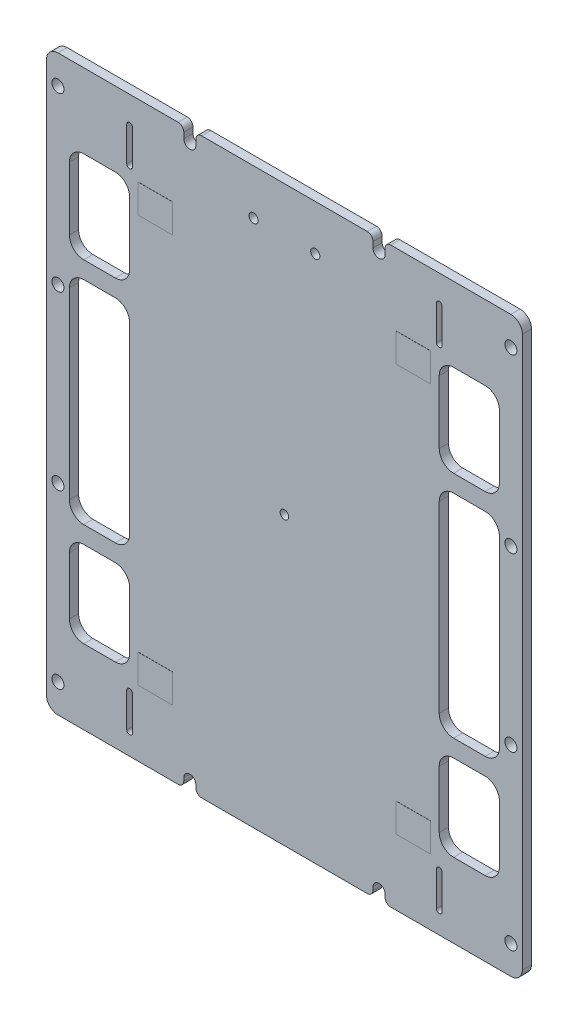
from build123d import *

# Parameters (mm, degrees)
BOARDOUTLINE_DEPTH          = 1.6
SKETCH2_R                   = 0.75
SKETCH2_R_2                 = 0.8
COMPONENTHOLES_DEPTH        = 65.998538445
SOLARCELLCONTACTHOLES_DEPTH = 1.6
WINDOWS_1SIDE_DEPTH         = 65.998538445
SKETCH5_W                   = 6
SKETCH5_H                   = 5
CONTACTPADS_DEPTH           = 0.02
M2_CLEARANCE_HOLE1_D        = 2.1
CUT_EXTRUDE1_DEPTH          = 65.999033839
FILLET3_R                   = 1
FILLET3_OF_MIRROR1_R        = 1


with BuildPart() as part:
    # Sketch1 → boardOutline (new body)
    with BuildSketch(Plane.XY):
        with BuildLine():
            Line((-39.5, -50), (39.5, -50))
            ThreePointArc((39.5, -50), (40.914213562, -49.414213562), (41.5, -48))
            Line((41.5, -48), (41.5, 48))
            ThreePointArc((41.5, 48), (40.914213562, 49.414213562), (39.5, 50))
            Line((39.5, 50), (-39.5, 50))
            ThreePointArc((-39.5, 50), (-40.914213562, 49.414213562), (-41.5, 48))
            Line((-41.5, 48), (-41.5, -48))
            ThreePointArc((-41.5, -48), (-40.914213562, -49.414213562), (-39.5, -50))
        make_face()
    extrude(amount=BOARDOUTLINE_DEPTH)

    # Sketch2 → componentHoles (cut, through all)
    with BuildSketch(Plane.XY.offset(1.6)):
        Circle(SKETCH2_R)
        with Locations((-5.385, 42.1)):
            Circle(SKETCH2_R_2)
        with Locations((5.385, 42.1)):
            Circle(SKETCH2_R_2)
    extrude(amount=-COMPONENTHOLES_DEPTH, mode=Mode.SUBTRACT)

    # Sketch4 → solarCellContactHoles (cut)
    with BuildSketch(Plane.XY.offset(1.6)):
        with BuildLine():
            Line((-27.5, 39.25), (-27.5, 45.25))
            ThreePointArc((-27.5, 45.25), (-27, 45.75), (-26.5, 45.25))
            Line((-26.5, 45.25), (-26.5, 39.25))
            ThreePointArc((-26.5, 39.25), (-27, 38.75), (-27.5, 39.25))
        make_face()
        with BuildLine():
            Line((26.5, 39.25), (26.5, 45.25))
            ThreePointArc((26.5, 45.25), (27, 45.75), (27.5, 45.25))
            Line((27.5, 45.25), (27.5, 39.25))
            ThreePointArc((27.5, 39.25), (27, 38.75), (26.5, 39.25))
        make_face()
        with BuildLine():
            Line((26.5, -46.25), (26.5, -40.25))
            ThreePointArc((26.5, -40.25), (27, -39.75), (27.5, -40.25))
            Line((27.5, -40.25), (27.5, -46.25))
            ThreePointArc((27.5, -46.25), (27, -46.75), (26.5, -46.25))
        make_face()
        with BuildLine():
            Line((-27.5, -46.25), (-27.5, -40.25))
            ThreePointArc((-27.5, -40.25), (-27, -39.75), (-26.5, -40.25))
            Line((-26.5, -40.25), (-26.5, -46.25))
            ThreePointArc((-26.5, -46.25), (-27, -46.75), (-27.5, -46.25))
        make_face()
    extrude(amount=-SOLARCELLCONTACTHOLES_DEPTH, mode=Mode.SUBTRACT)

    # Sketch3 → windows_1side (cut, through all)
    with BuildSketch(Plane.XY.offset(1.6)):
        with BuildLine():
            Line((-35, 37), (-29.5, 37))
            ThreePointArc((-29.5, 37), (-27.732233047, 36.267766953), (-27, 34.5))
            Line((-27, 34.5), (-27, 23.5))
            ThreePointArc((-27, 23.5), (-27.732233047, 21.732233047), (-29.5, 21))
            Line((-29.5, 21), (-35, 21))
            ThreePointArc((-35, 21), (-36.767766953, 21.732233047), (-37.5, 23.5))
            Line((-37.5, 23.5), (-37.5, 34.5))
            ThreePointArc((-37.5, 34.5), (-36.767766953, 36.267766953), (-35, 37))
        make_face()
        with BuildLine():
            Line((-29.5, -22), (-35, -22))
            ThreePointArc((-35, -22), (-36.767766953, -22.732233047), (-37.5, -24.5))
            Line((-37.5, -24.5), (-37.5, -34.5))
            ThreePointArc((-37.5, -34.5), (-36.767766953, -36.267766953), (-35, -37))
            Line((-35, -37), (-29.5, -37))
            ThreePointArc((-29.5, -37), (-27.732233047, -36.267766953), (-27, -34.5))
            Line((-27, -34.5), (-27, -24.5))
            ThreePointArc((-27, -24.5), (-27.732233047, -22.732233047), (-29.5, -22))
        make_face()
        with BuildLine():
            Line((-29.5, -19), (-35, -19))
            ThreePointArc((-35, -19), (-36.767766953, -18.267766953), (-37.5, -16.5))
            Line((-37.5, -16.5), (-37.5, 15.5))
            ThreePointArc((-37.5, 15.5), (-36.767766953, 17.267766953), (-35, 18))
            Line((-35, 18), (-29.5, 18))
            ThreePointArc((-29.5, 18), (-27.732233047, 17.267766953), (-27, 15.5))
            Line((-27, 15.5), (-27, -16.5))
            ThreePointArc((-27, -16.5), (-27.732233047, -18.267766953), (-29.5, -19))
        make_face()
    windows_1side = extrude(amount=-WINDOWS_1SIDE_DEPTH, mode=Mode.SUBTRACT)

    # Sketch5 → contactPads (add)
    with BuildSketch(Plane.XY.offset(1.6)):
        with Locations((-22.5, 35)):
            Rectangle(SKETCH5_W, SKETCH5_H)
        with Locations((22.5, 35)):
            Rectangle(SKETCH5_W, SKETCH5_H)
        with Locations((22.5, -36)):
            Rectangle(SKETCH5_W, SKETCH5_H)
        with Locations((-22.5, -36)):
            Rectangle(SKETCH5_W, SKETCH5_H)
    extrude(amount=CONTACTPADS_DEPTH)

    # M2 Clearance Hole1 (through all)
    with Locations(Plane(origin=(0, 0, 0), x_dir=(-1, 0, 0), z_dir=(0, 0, -1))):
        with Locations((39.5, 45), (39.5, -15), (39.5, -45), (39.5, 15)):
            m2_clearance_hole1 = Hole(M2_CLEARANCE_HOLE1_D / 2)

    # Sketch10 → Cut-Extrude1 (cut, symmetric)
    with BuildSketch(Plane(origin=(0, 0, 0), x_dir=(-1, 0, 0), z_dir=(0, 0, -1))):
        with BuildLine():
            Line((15.45, 48), (15.45, 55.073166109))
            ThreePointArc((15.45, 55.073166109), (16.5, 56.123166109), (17.55, 55.073166109))
            Line((17.55, 55.073166109), (17.55, 48))
            ThreePointArc((17.55, 48), (16.5, 46.95), (15.45, 48))
        make_face()
        with BuildLine():
            Line((17.55, -48.5), (17.55, -55.573166109))
            ThreePointArc((17.55, -55.573166109), (16.5, -56.623166109), (15.45, -55.573166109))
            Line((15.45, -55.573166109), (15.45, -48.5))
            ThreePointArc((15.45, -48.5), (16.5, -47.45), (17.55, -48.5))
        make_face()
    cut_extrude1 = extrude(amount=CUT_EXTRUDE1_DEPTH, both=True, mode=Mode.SUBTRACT)

    # Fillet3
    fillet3_edges = [part.edges().sort_by_distance(p)[0] for p in [
        (-17.55, 50, 0.8),
        (-15.45, 50, 0.8),
        (-15.45, -50, 0.8),
        (-17.55, -50, 0.8),
    ]]
    fillet(fillet3_edges, radius=FILLET3_R)

    # Mirror1: windows_1side, M2 Clearance Hole1, Cut-Extrude1 across plane
    add(windows_1side.mirror(Plane(origin=(0, 0, 0), x_dir=(0, 0, 1), z_dir=(1, 0, 0))), mode=Mode.SUBTRACT)
    add(m2_clearance_hole1.mirror(Plane(origin=(0, 0, 0), x_dir=(0, 0, 1), z_dir=(1, 0, 0))), mode=Mode.SUBTRACT)
    add(cut_extrude1.mirror(Plane(origin=(0, 0, 0), x_dir=(0, 0, 1), z_dir=(1, 0, 0))), mode=Mode.SUBTRACT)

    # Fillet3 of Mirror1
    fillet3_of_mirror1_edges = [part.edges().sort_by_distance(p)[0] for p in [
        (17.55, 50, 0.8),
        (15.45, 50, 0.8),
        (15.45, -50, 0.8),
        (17.55, -50, 0.8),
    ]]
    fillet(fillet3_of_mirror1_edges, radius=FILLET3_OF_MIRROR1_R)


solid = part.part
